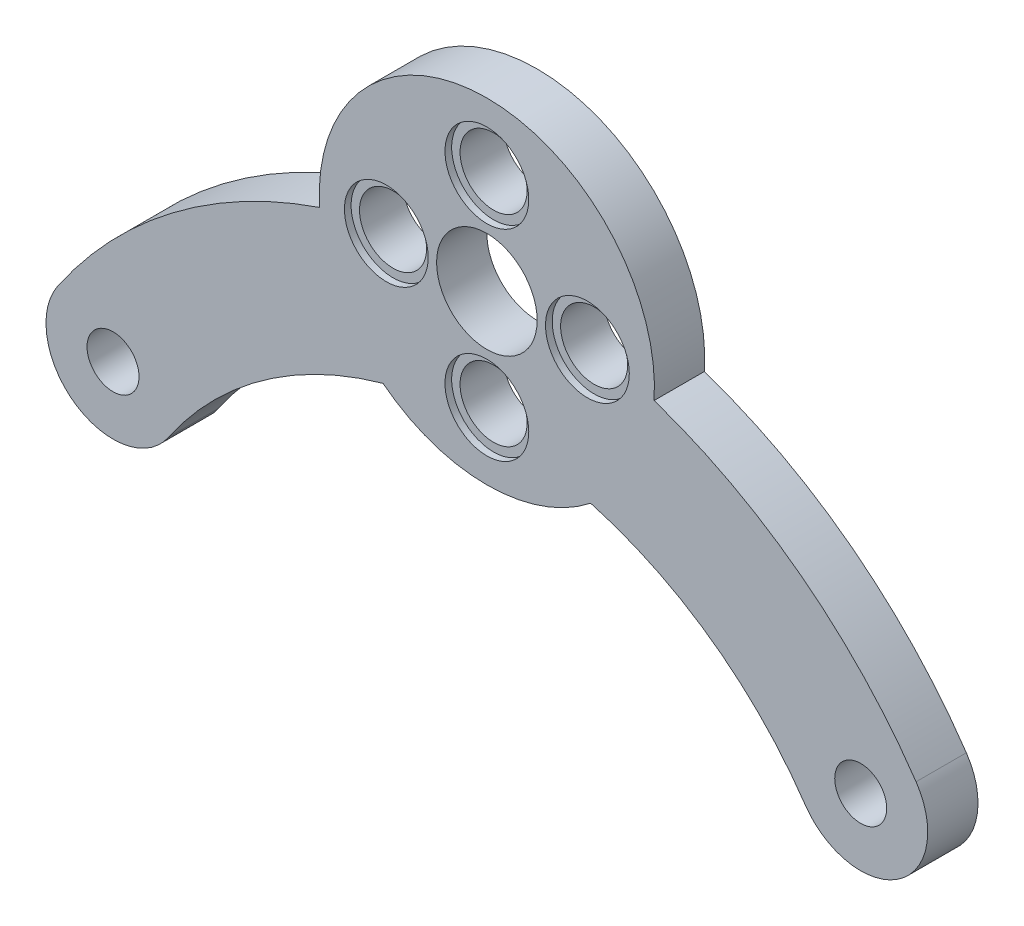
from build123d import *

# Parameters (mm, degrees)
BOSS_EXTRU_1_DEPTH           = 3
BOSS_EXTRU_2_START           = -3
ESQUISSE3_R                  = 10
BOSS_EXTRU_2_DEPTH           = 3
CONG_1_R                     = 4
ENL_V_MAT_EXTRU_1_DEPTH      = 48.969384742
ENL_V_MAT_EXTRU_1_DEPTH_BACK = 48.969384742
ESQUISSE2_R                  = 3
ESQUISSE2_R_2                = 2
ENL_V_MAT_EXTRU_2_DEPTH      = 48.969384742
ENL_V_MAT_EXTRU_2_DEPTH_BACK = 48.969384742
ESQUISSE4_R                  = 1.55
ESQUISSE5_R                  = 2.5
ENL_V_MAT_EXTRU_3_DEPTH      = 0.4


with BuildPart() as part:
    # Esquisse1 → Boss.-Extru.1 (new body)
    with BuildSketch(Plane.XY):
        with BuildLine():
            Line((27.916598717, 13.47826087), (20.712315177, 10))
            ThreePointArc((20.712315177, 10), (0, 23), (-20.712315177, 10))
            Line((-20.712315177, 10), (-27.916598717, 13.47826087))
            ThreePointArc((-27.916598717, 13.47826087), (-20.542500679, 23.216495555), (-9.978852639, 29.35))
            ThreePointArc((-9.978852639, 29.35), (0, 40), (9.978852639, 29.35))
            ThreePointArc((9.978852639, 29.35), (20.542500679, 23.216495555), (27.916598717, 13.47826087))
        make_face()
    extrude(amount=BOSS_EXTRU_1_DEPTH)

    # Esquisse3 → Boss.-Extru.2 (add)
    with BuildSketch(Plane.XY.offset(3).offset(BOSS_EXTRU_2_START)):
        with Locations((0, 30)):
            Circle(ESQUISSE3_R)
    extrude(amount=BOSS_EXTRU_2_DEPTH)

    # Congé1
    cong_1_edges = [part.edges().sort_by_distance(p)[0] for p in [
        (-27.916598717, 13.47826087, 1.5),
        (-20.712315177, 10, 1.5),
        (20.712315177, 10, 1.5),
        (27.916598717, 13.47826087, 1.5),
    ]]
    fillet(cong_1_edges, radius=CONG_1_R - 0.0001)  # a hair under: the kernel refuses the full size

    # Esquisse2 → Enlèv. mat.-Extru.1 (cut, two sides: drawn at the far end of the back side and taken through both)
    with BuildSketch(Plane.XY.offset(3).offset(-ENL_V_MAT_EXTRU_1_DEPTH_BACK)):
        with Locations((0, 30)):
            Circle(ESQUISSE2_R)
        with Locations((6, 30)):
            Circle(ESQUISSE2_R_2)
        with Locations((0, 24)):
            Circle(ESQUISSE2_R_2)
        with Locations((-6, 30)):
            Circle(ESQUISSE2_R_2)
        with Locations((0, 36)):
            Circle(ESQUISSE2_R_2)
    extrude(amount=ENL_V_MAT_EXTRU_1_DEPTH + ENL_V_MAT_EXTRU_1_DEPTH_BACK, mode=Mode.SUBTRACT)

    # Esquisse4 → Enlèv. mat.-Extru.2 (cut, two sides: drawn at the far end of the back side and taken through both)
    with BuildSketch(Plane.XY.offset(3).offset(-ENL_V_MAT_EXTRU_2_DEPTH_BACK)):
        with Locations((22.307020844, 15.211733007)):
            Circle(ESQUISSE4_R)
        with Locations((-22.307020844, 15.211733007)):
            Circle(ESQUISSE4_R)
    extrude(amount=ENL_V_MAT_EXTRU_2_DEPTH + ENL_V_MAT_EXTRU_2_DEPTH_BACK, mode=Mode.SUBTRACT)

    # Esquisse5 → Enlèv. mat.-Extru.3 (cut)
    with BuildSketch(Plane.XY.offset(3)):
        with Locations((0, 24)):
            Circle(ESQUISSE5_R)
        with Locations((6, 30)):
            Circle(ESQUISSE5_R)
        with Locations((0, 36)):
            Circle(ESQUISSE5_R)
        with Locations((-6, 30)):
            Circle(ESQUISSE5_R)
    extrude(amount=-ENL_V_MAT_EXTRU_3_DEPTH, mode=Mode.SUBTRACT)


solid = part.part
